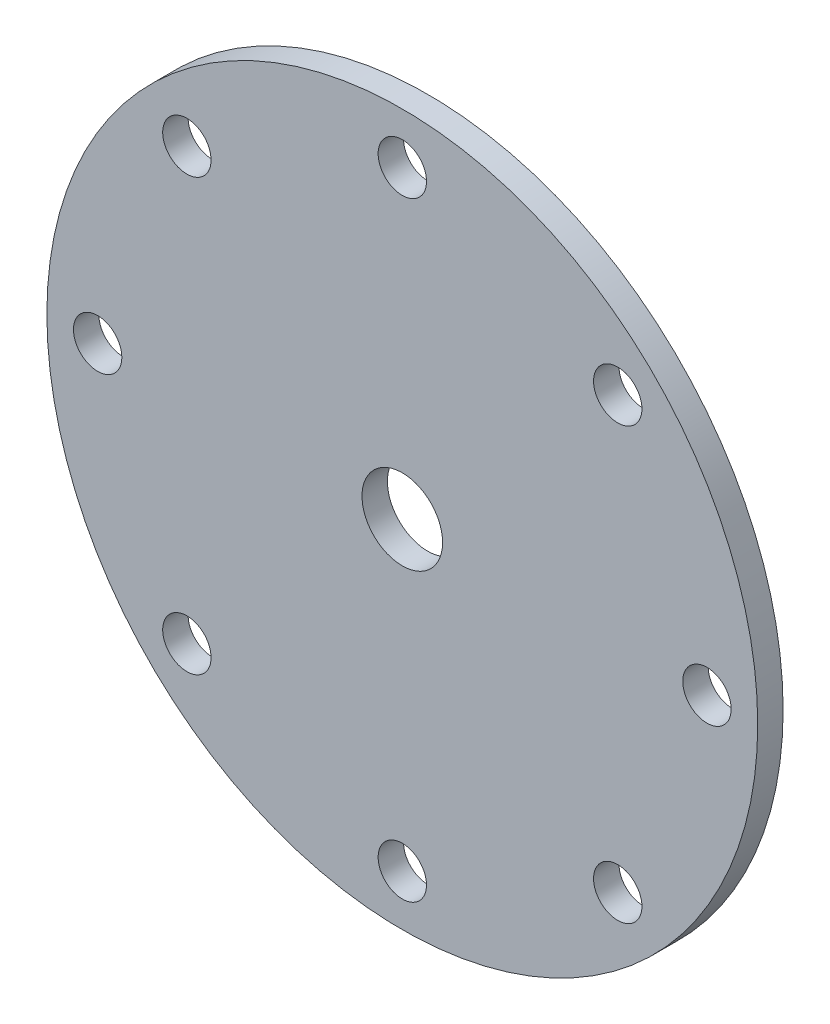
from build123d import *

# Parameters (mm, degrees)
SKETCH1_R        = 70
SKETCH1_R_2      = 4.7625
SKETCH1_R_3      = 7.9375
ROTOR_DISC_DEPTH = 5


with BuildPart() as part:
    # Sketch1 → Rotor Disc (new body)
    with BuildSketch(Plane.XY):
        Circle(SKETCH1_R)
        with Locations((-42.426406871, -42.426406871)):
            Circle(SKETCH1_R_2, mode=Mode.SUBTRACT)
        with Locations((-60, 0)):
            Circle(SKETCH1_R_2, mode=Mode.SUBTRACT)
        with Locations((0, -60)):
            Circle(SKETCH1_R_2, mode=Mode.SUBTRACT)
        with Locations((42.426406871, -42.426406871)):
            Circle(SKETCH1_R_2, mode=Mode.SUBTRACT)
        with Locations((-42.426406871, 42.426406871)):
            Circle(SKETCH1_R_2, mode=Mode.SUBTRACT)
        Circle(SKETCH1_R_3, mode=Mode.SUBTRACT)
        with Locations((60, 0)):
            Circle(SKETCH1_R_2, mode=Mode.SUBTRACT)
        with Locations((0, 60)):
            Circle(SKETCH1_R_2, mode=Mode.SUBTRACT)
        with Locations((42.426406871, 42.426406871)):
            Circle(SKETCH1_R_2, mode=Mode.SUBTRACT)
    extrude(amount=ROTOR_DISC_DEPTH)


solid = part.part
